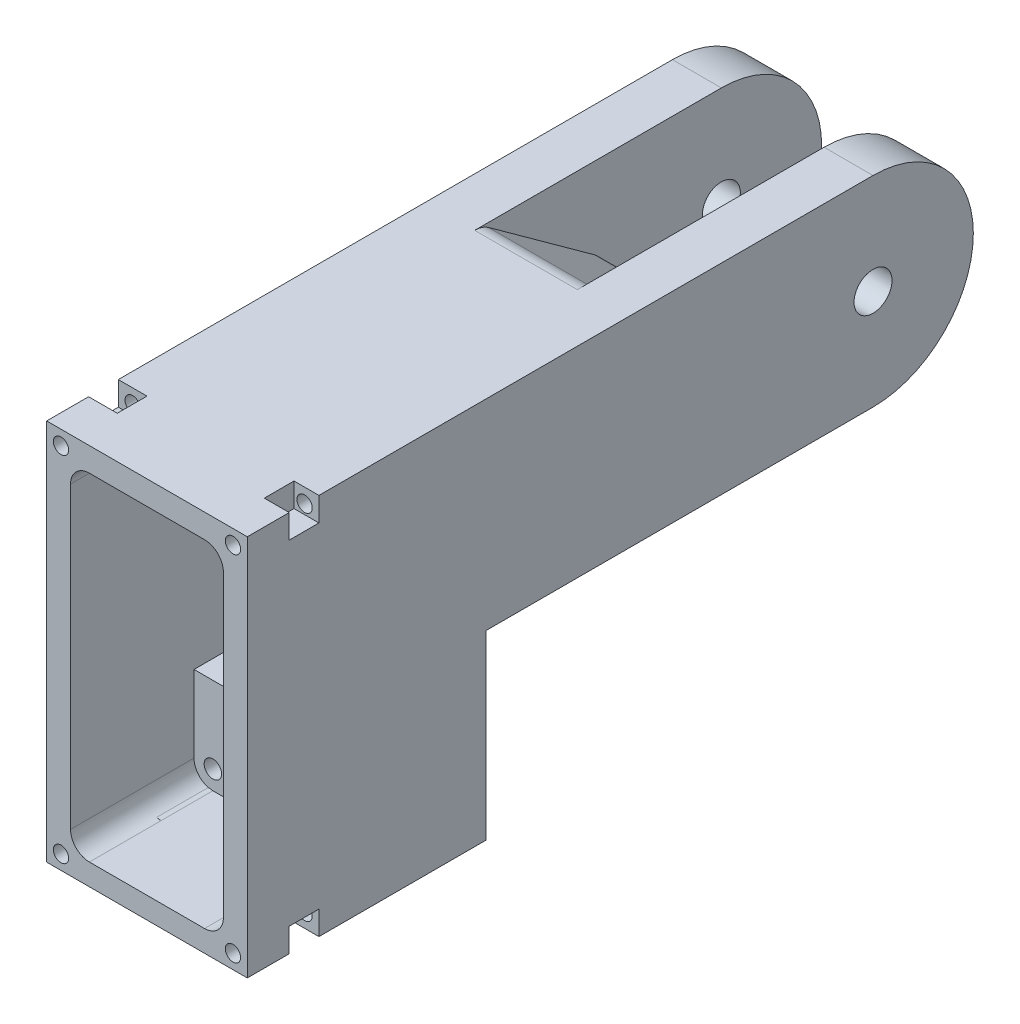
from build123d import *

# Parameters (mm, degrees)
SKETCH2_W            = 42
SKETCH2_H            = 42
BOSS_EXTRUDE1_DEPTH  = 60
SKETCH3_W            = 10.25
SKETCH3_H            = 42
BOSS_EXTRUDE2_DEPTH  = 21
BOSS_EXTRUDE3_DEPTH  = 10.25
BOSS_EXTRUDE4_START  = -10.25
BOSS_EXTRUDE4_DEPTH  = 10.25
SKETCH6_W            = 32
SKETCH6_H            = 32
CUT_EXTRUDE1_DEPTH   = 27
SKETCH7_R            = 3.975
CUT_EXTRUDE2_DEPTH   = 72.056755485
SKETCH9_R            = 3.975
CUT_EXTRUDE3_DEPTH   = 72.056755485
CUT_EXTRUDE5_DEPTH   = 21.5
FILLET1_R            = 5
FILLET2_R            = 5
FILLET3_R            = 5
SKETCH12_W           = 42
SKETCH12_H           = 80
BOSS_EXTRUDE5_DEPTH  = 50
SKETCH13_W           = 32
SKETCH13_H           = 70.5
CUT_EXTRUDE7_DEPTH   = 40.5
SKETCH14_W           = 26
SKETCH14_H           = 10.847627818
CUT_EXTRUDE8_DEPTH   = 40.5
SKETCH15_W           = 26
SKETCH15_H           = 10.58
CUT_EXTRUDE9_DEPTH   = 40.5
FILLET4_R            = 3.95
SKETCH16_R           = 1.825
CUT_EXTRUDE10_DEPTH  = 20
SKETCH18_R           = 1.83
SKETCH18_R_2         = 1.8275
BOSS_EXTRUDE7_DEPTH  = 14.652372
SKETCH19_R           = 1.6
CUT_EXTRUDE11_DEPTH  = 30
SKETCH23_W           = 6
SKETCH23_H           = 6.221820756
CUT_EXTRUDE14_DEPTH  = 5
SKETCH25_W           = 6
SKETCH25_H           = 6.22
CUT_EXTRUDE15_DEPTH  = 5
SKETCH26_W           = 6
SKETCH26_H           = 6.22
SKETCH26_W_2         = 5.221866826
CUT_EXTRUDE16_DEPTH  = 5
SKETCH27_R           = 1.975
CUT_EXTRUDE17_DEPTH  = 4
SKETCH28_W           = 32
SKETCH28_H           = 11.955388495
CUT_EXTRUDE18_DEPTH  = 4
BOSS_EXTRUDE8_DEPTH  = 10.847628
SKETCH30_W           = 26
SKETCH30_H           = 10.58
CUT_EXTRUDE19_DEPTH  = 20
SKETCH31_W           = 32
SKETCH31_H           = 10.58
CUT_EXTRUDE20_DEPTH  = 20
SKETCH32_W           = 26
SKETCH32_H           = 14.65
BOSS_EXTRUDE9_DEPTH  = 9.52
BOSS_EXTRUDE10_START = -9.5
SKETCH33_W           = 26
SKETCH33_H           = 1.06
BOSS_EXTRUDE10_DEPTH = 9.5


with BuildPart() as part:
    # Sketch2 → Boss-Extrude1 (new body)
    with BuildSketch(Plane.XY):
        Rectangle(SKETCH2_W, SKETCH2_H)
    extrude(amount=BOSS_EXTRUDE1_DEPTH)

    # Sketch3 → Boss-Extrude2 (add)
    with BuildSketch(Plane(origin=(0, 0, 0), x_dir=(-1, 0, 0), z_dir=(0, 0, -1))):
        with Locations((15.875, 0)):
            Rectangle(SKETCH3_W, SKETCH3_H)
        with Locations((-15.875, 0)):
            Rectangle(SKETCH3_W, SKETCH3_H)
    extrude(amount=BOSS_EXTRUDE2_DEPTH)

    # Sketch4 → Boss-Extrude3 (add)
    with BuildSketch(Plane.ZY.offset(21)):
        with BuildLine():
            Line((-21, -21), (-21, 21))
            ThreePointArc((-21, 21), (-42, 0), (-21, -21))
        make_face()
    extrude(amount=-BOSS_EXTRUDE3_DEPTH)

    # Sketch5 → Boss-Extrude4 (add)
    with BuildSketch(Plane(origin=(21, 0, 0), x_dir=(0, 0, -1), z_dir=(1, 0, 0)).offset(BOSS_EXTRUDE4_START)):
        with BuildLine():
            Line((21, 21), (21, -21))
            ThreePointArc((21, -21), (42, 0), (21, 21))
        make_face()
    extrude(amount=BOSS_EXTRUDE4_DEPTH)

    # Sketch6 → Cut-Extrude1 (cut)
    with BuildSketch(Plane.XY.offset(60)):
        Rectangle(SKETCH6_W, SKETCH6_H)
    extrude(amount=-CUT_EXTRUDE1_DEPTH, mode=Mode.SUBTRACT)

    # Sketch7 → Cut-Extrude2 (cut, through all)
    with BuildSketch(Plane.ZY.offset(-10.75)):
        with Locations((-21, 0)):
            Circle(SKETCH7_R)
    extrude(amount=-CUT_EXTRUDE2_DEPTH, mode=Mode.SUBTRACT)

    # Sketch9 → Cut-Extrude3 (cut, through all)
    with BuildSketch(Plane(origin=(-10.75, 0, 0), x_dir=(0, 0, -1), z_dir=(1, 0, 0))):
        with Locations(Location((21, 0, 0), (0, 0, 180))):
            Circle(SKETCH9_R)
    extrude(amount=-CUT_EXTRUDE3_DEPTH, mode=Mode.SUBTRACT)

    # Sketch11 → Cut-Extrude5 (cut)
    with BuildSketch(Plane.ZY.offset(-10.75)):
        Polygon((0, 21), (0, 0), (29.025198915, 21), align=None)
        Polygon((0, 0), (0, -21), (29.025198915, -21), align=None)
    extrude(amount=CUT_EXTRUDE5_DEPTH, mode=Mode.SUBTRACT)

    # Fillet1
    fillet1_edges = [part.edges().sort_by_distance(p)[0] for p in [
        (0, 0, 0),
    ]]
    fillet(fillet1_edges, radius=FILLET1_R)

    # Fillet2
    fillet2_edges = [part.edges().sort_by_distance(p)[0] for p in [
        (0, -21, 29.025198915),
    ]]
    fillet(fillet2_edges, radius=FILLET2_R)

    # Fillet3
    fillet3_edges = [part.edges().sort_by_distance(p)[0] for p in [
        (0, 21, 29.025198915),
    ]]
    fillet(fillet3_edges, radius=FILLET3_R)

    # Sketch12 → Boss-Extrude5 (add)
    with BuildSketch(Plane.XY.offset(60)):
        with Locations((0, -19)):
            Rectangle(SKETCH12_W, SKETCH12_H)
    extrude(amount=BOSS_EXTRUDE5_DEPTH)

    # Sketch13 → Cut-Extrude7 (cut)
    with BuildSketch(Plane.XY.offset(110)):
        with Locations((0, -19.25)):
            Rectangle(SKETCH13_W, SKETCH13_H)
    extrude(amount=-CUT_EXTRUDE7_DEPTH, mode=Mode.SUBTRACT)

    # Sketch14 → Cut-Extrude8 (cut)
    with BuildSketch(Plane(origin=(0, -59, 0), x_dir=(-1, 0, 0), z_dir=(0, -1, 0))):
        with Locations((0, -89.576186091)):
            Rectangle(SKETCH14_W, SKETCH14_H)
    extrude(amount=-CUT_EXTRUDE8_DEPTH, mode=Mode.SUBTRACT)

    # Sketch15 → Cut-Extrude9 (cut)
    with BuildSketch(Plane(origin=(0, 0, 60), x_dir=(-1, 0, 0), z_dir=(0, 0, -1))):
        with Locations((0, -38.71)):
            Rectangle(SKETCH15_W, SKETCH15_H)
    extrude(amount=-CUT_EXTRUDE9_DEPTH, mode=Mode.SUBTRACT)

    # Fillet4
    # the kernel refuses this fillet: 3.95 mm, written as the material it adds along each edge
    with BuildSketch(Plane(origin=(-16, -54.5, 110), x_dir=(0, 1, 0), z_dir=(0, 0, -1))) as fillet4_piece_1_section:
        with BuildLine():
            CenterArc((FILLET4_R, FILLET4_R), FILLET4_R, 180, 90)
            Line((0, FILLET4_R), (0, 0))
            Line((0, 0), (FILLET4_R, 0))
        make_face()
    fillet4_piece_1 = extrude(amount=40.5, mode=Mode.PRIVATE)
    fillet4_piece_1 = split(fillet4_piece_1, bisect_by=Plane(origin=(-13, -53.608355885, 102.5), z_dir=(-1, 0, 0)), keep=Keep.TOP, mode=Mode.PRIVATE)
    add(fillet4_piece_1)
    with BuildSketch(Plane(origin=(-16, -54.5, 110), x_dir=(0, 1, 0), z_dir=(0, 0, -1))) as fillet4_piece_2_section:
        with BuildLine():
            CenterArc((FILLET4_R, FILLET4_R), FILLET4_R, 180, 90)
            Line((0, FILLET4_R), (0, 0))
            Line((0, 0), (FILLET4_R, 0))
        make_face()
    fillet4_piece_2 = extrude(amount=50.375, mode=Mode.PRIVATE)
    fillet4_piece_2 = split(fillet4_piece_2, bisect_by=Plane(origin=(-12.763202693, -54.465306666, 95), z_dir=(0, 0, 1)), keep=Keep.TOP, mode=Mode.PRIVATE)
    add(fillet4_piece_2)
    with BuildSketch(Plane(origin=(-16, -54.5, 119.875), x_dir=(0, 1, 0), z_dir=(0, 0, -1))) as fillet4_piece_3_section:
        with BuildLine():
            CenterArc((FILLET4_R, FILLET4_R), FILLET4_R, 180, 90)
            Line((0, FILLET4_R), (0, 0))
            Line((0, 0), (FILLET4_R, 0))
        make_face()
    fillet4_piece_3 = extrude(amount=50.375, mode=Mode.PRIVATE)
    fillet4_piece_3 = split(fillet4_piece_3, bisect_by=Plane(origin=(-12.763202693, -54.465306666, 84.152372182), z_dir=(0, 0, -1)), keep=Keep.TOP, mode=Mode.PRIVATE)
    add(fillet4_piece_3)
    with BuildSketch(Plane(origin=(16, -54.5, 110), x_dir=(-1, 0, 0), z_dir=(0, 0, -1))) as fillet4_piece_4_section:
        with BuildLine():
            CenterArc((FILLET4_R, FILLET4_R), FILLET4_R, 180, 90)
            Line((0, FILLET4_R), (0, 0))
            Line((0, 0), (FILLET4_R, 0))
        make_face()
    fillet4_piece_4 = extrude(amount=50.375, mode=Mode.PRIVATE)
    fillet4_piece_4 = split(fillet4_piece_4, bisect_by=Plane(origin=(12.763202693, -54.465306666, 95), z_dir=(0, 0, 1)), keep=Keep.TOP, mode=Mode.PRIVATE)
    add(fillet4_piece_4)
    with BuildSketch(Plane(origin=(16, -54.5, 119.875), x_dir=(-1, 0, 0), z_dir=(0, 0, -1))) as fillet4_piece_5_section:
        with BuildLine():
            CenterArc((FILLET4_R, FILLET4_R), FILLET4_R, 180, 90)
            Line((0, FILLET4_R), (0, 0))
            Line((0, 0), (FILLET4_R, 0))
        make_face()
    fillet4_piece_5 = extrude(amount=50.375, mode=Mode.PRIVATE)
    fillet4_piece_5 = split(fillet4_piece_5, bisect_by=Plane(origin=(15.143643425, -53.608355885, 95), z_dir=(0, 0, -1)), keep=Keep.TOP, mode=Mode.PRIVATE)
    fillet4_piece_5 = split(fillet4_piece_5, bisect_by=Plane(origin=(13, -53.608355885, 89.576186091), z_dir=(1, 0, 0)), keep=Keep.TOP, mode=Mode.PRIVATE)
    add(fillet4_piece_5)
    with BuildSketch(Plane(origin=(16, -54.5, 119.875), x_dir=(-1, 0, 0), z_dir=(0, 0, -1))) as fillet4_piece_6_section:
        with BuildLine():
            CenterArc((FILLET4_R, FILLET4_R), FILLET4_R, 180, 90)
            Line((0, FILLET4_R), (0, 0))
            Line((0, 0), (FILLET4_R, 0))
        make_face()
    fillet4_piece_6 = extrude(amount=50.375, mode=Mode.PRIVATE)
    fillet4_piece_6 = split(fillet4_piece_6, bisect_by=Plane(origin=(12.763202693, -54.465306666, 84.152372182), z_dir=(0, 0, -1)), keep=Keep.TOP, mode=Mode.PRIVATE)
    add(fillet4_piece_6)
    with BuildSketch(Plane(origin=(-16, 16, 110), x_dir=(1, 0, 0), z_dir=(0, 0, -1))) as fillet4_piece_7_section:
        with BuildLine():
            CenterArc((FILLET4_R, FILLET4_R), FILLET4_R, 180, 90)
            Line((0, FILLET4_R), (0, 0))
            Line((0, 0), (FILLET4_R, 0))
        make_face()
    fillet4_piece_7 = extrude(amount=50.375, mode=Mode.PRIVATE)
    fillet4_piece_7 = split(fillet4_piece_7, bisect_by=Plane(origin=(-15.117696641, 15.117696641, 60), z_dir=(0, 0, 1)), keep=Keep.TOP, mode=Mode.PRIVATE)
    add(fillet4_piece_7)
    with BuildSketch(Plane(origin=(16, 16, 110), x_dir=(-1, 0, 0), z_dir=(0, 0, -1))) as fillet4_piece_8_section:
        with BuildLine():
            CenterArc((FILLET4_R, -FILLET4_R), FILLET4_R, 90, 90)
            Line((0, -FILLET4_R), (0, 0))
            Line((0, 0), (FILLET4_R, 0))
        make_face()
    fillet4_piece_8 = extrude(amount=50.375, mode=Mode.PRIVATE)
    fillet4_piece_8 = split(fillet4_piece_8, bisect_by=Plane(origin=(15.117696641, 15.117696641, 60), z_dir=(0, 0, 1)), keep=Keep.TOP, mode=Mode.PRIVATE)
    add(fillet4_piece_8)

    # Sketch16 → Cut-Extrude10 (cut)
    with BuildSketch(Plane.XY.offset(69.5)):
        with Locations((11.995, 11.995)):
            Circle(SKETCH16_R)
        with Locations((-11.995, 11.995)):
            Circle(SKETCH16_R)
        with Locations((-11.995, -50.495)):
            Circle(SKETCH16_R)
        with Locations((11.995, -50.495)):
            Circle(SKETCH16_R)
    extrude(amount=-CUT_EXTRUDE10_DEPTH, mode=Mode.SUBTRACT)

    # Sketch18 → Boss-Extrude7 (add)
    with BuildSketch(Plane.XY.offset(69.5)):
        with BuildLine():
            Line((-13, -34.48), (-13, -44))
            Line((-13, -44), (13, -44))
            Line((13, -44), (13, -34.48))
            Line((13, -34.48), (16, -34.48))
            Line((16, -34.48), (16, -50.55))
            ThreePointArc((16, -50.55), (14.843071786, -53.343071786), (12.05, -54.5))
            Line((12.05, -54.5), (-12.05, -54.5))
            ThreePointArc((-12.05, -54.5), (-14.843071786, -53.343071786), (-16, -50.55))
            Line((-16, -50.55), (-16, -34.48))
            Line((-16, -34.48), (-13, -34.48))
        make_face()
        with Locations(Location((12.05, -50.55, 0), (0, 0, 220.098301437))):
            Circle(SKETCH18_R, mode=Mode.SUBTRACT)
        with Locations(Location((-12.05, -50.55, 0), (0, 0, 131.93894089))):
            Circle(SKETCH18_R_2, mode=Mode.SUBTRACT)
    extrude(amount=BOSS_EXTRUDE7_DEPTH)

    # Sketch19 → Cut-Extrude11 (cut)
    with BuildSketch(Plane.XY.offset(110)):
        with Locations((18, 18)):
            Circle(SKETCH19_R)
        with Locations((-18, 18)):
            Circle(SKETCH19_R)
        with Locations((-18, -56)):
            Circle(SKETCH19_R)
        with Locations((18, -56)):
            Circle(SKETCH19_R)
    extrude(amount=-CUT_EXTRUDE11_DEPTH, mode=Mode.SUBTRACT)

    # Sketch23 → Cut-Extrude14 (cut)
    with BuildSketch(Plane(origin=(0, -59, 0), x_dir=(-1, 0, 0), z_dir=(0, -1, 0))):
        with Locations((-18, -98.110910378)):
            Rectangle(SKETCH23_W, SKETCH23_H)
    extrude(amount=-CUT_EXTRUDE14_DEPTH, mode=Mode.SUBTRACT)

    # Sketch25 → Cut-Extrude15 (cut)
    with BuildSketch(Plane(origin=(0, -59, 0), x_dir=(-1, 0, 0), z_dir=(0, -1, 0))):
        with Locations((18, -98.11)):
            Rectangle(SKETCH25_W, SKETCH25_H)
    extrude(amount=-CUT_EXTRUDE15_DEPTH, mode=Mode.SUBTRACT)

    # Sketch26 → Cut-Extrude16 (cut)
    with BuildSketch(Plane(origin=(0, 21, 0), x_dir=(1, 0, 0), z_dir=(0, 1, 0))):
        with Locations((-18, -98.11)):
            Rectangle(SKETCH26_W, SKETCH26_H)
        with Locations((18.389066587, -98.11)):
            Rectangle(SKETCH26_W_2, SKETCH26_H)
    extrude(amount=-CUT_EXTRUDE16_DEPTH, mode=Mode.SUBTRACT)

    # Sketch27 → Cut-Extrude17 (cut)
    with BuildSketch(Plane.XY.offset(69.5)):
        with Locations((0, 4.5)):
            Circle(SKETCH27_R)
    extrude(amount=-CUT_EXTRUDE17_DEPTH, mode=Mode.SUBTRACT)

    # Sketch28 → Cut-Extrude18 (cut)
    with BuildSketch(Plane.XY.offset(69.5)):
        with Locations((0, -21.477694248)):
            Rectangle(SKETCH28_W, SKETCH28_H)
    extrude(amount=-CUT_EXTRUDE18_DEPTH, mode=Mode.SUBTRACT)

    # Sketch29 → Boss-Extrude8 (add)
    with BuildSketch(Plane(origin=(0, 0, 95), x_dir=(-1, 0, 0), z_dir=(0, 0, -1))):
        Polygon((13, -59), (-13, -59), (-13, -54.384057903), (-12.05, -54.5), (12.05, -54.5), (13, -54.384057903), align=None)
    extrude(amount=BOSS_EXTRUDE8_DEPTH)

    # Sketch30 → Cut-Extrude19 (cut)
    with BuildSketch(Plane.XY.offset(69.5)):
        with Locations((0, -9.21)):
            Rectangle(SKETCH30_W, SKETCH30_H)
    extrude(amount=-CUT_EXTRUDE19_DEPTH, mode=Mode.SUBTRACT)

    # Sketch31 → Cut-Extrude20 (cut)
    with BuildSketch(Plane(origin=(0, -21, 0), x_dir=(-1, 0, 0), z_dir=(0, -1, 0))):
        with Locations((0, -48.018950811)):
            Rectangle(SKETCH31_W, SKETCH31_H)
    extrude(amount=-CUT_EXTRUDE20_DEPTH, mode=Mode.SUBTRACT)

    # Sketch32 → Boss-Extrude9 (add)
    with BuildSketch(Plane(origin=(0, -44, 0), x_dir=(1, 0, 0), z_dir=(0, 1, 0))):
        with Locations((0, -76.827372182)):
            Rectangle(SKETCH32_W, SKETCH32_H)
    extrude(amount=BOSS_EXTRUDE9_DEPTH)

    # Sketch33 → Boss-Extrude10 (add)
    with BuildSketch(Plane.XY.offset(69.5).offset(BOSS_EXTRUDE10_START)):
        with Locations((0, -33.95)):
            Rectangle(SKETCH33_W, SKETCH33_H)
    extrude(amount=BOSS_EXTRUDE10_DEPTH)


solid = part.part
